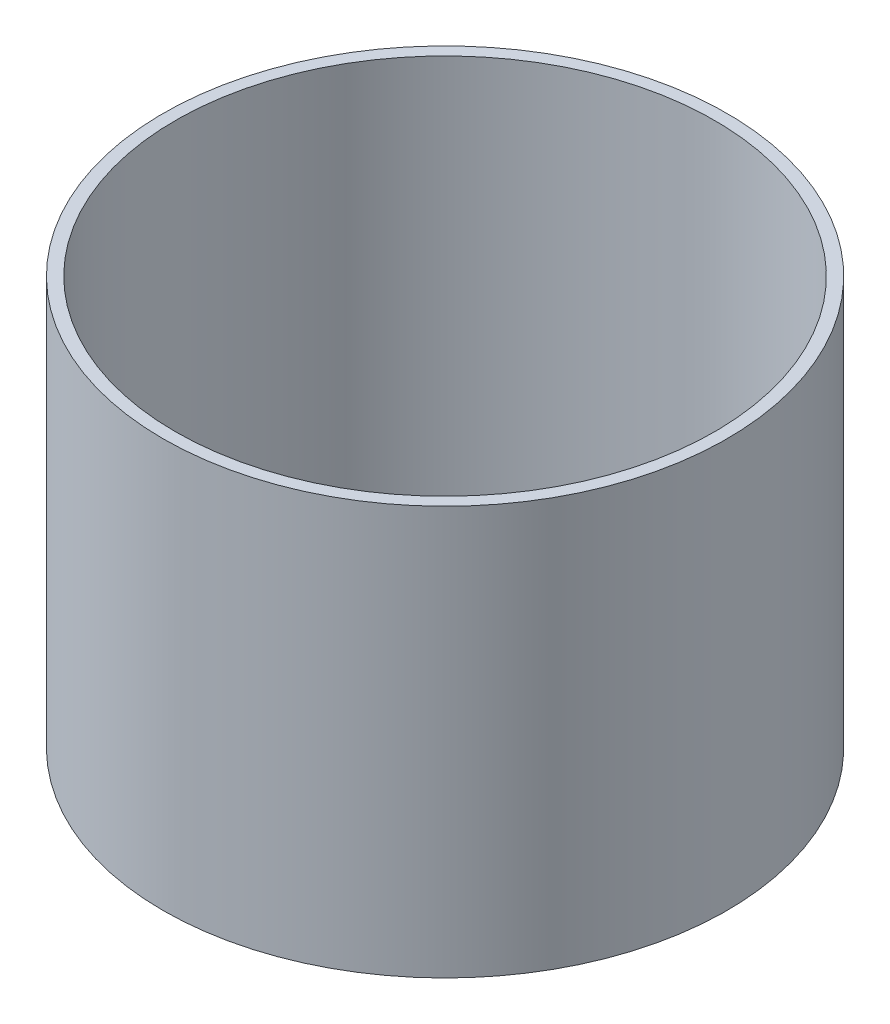
from build123d import *

# Parameters (mm, degrees)
SKETCH1_R           = 69
SKETCH1_R_2         = 66
BOSS_EXTRUDE1_DEPTH = 100
CUT_EXTRUDE1_REACH  = 200.784
SKETCH3_W           = 20
SKETCH3_H           = 28
FILLET1_R           = 3


with BuildPart() as part:
    # Sketch1 → Boss-Extrude1 (new body)
    with BuildSketch(Plane(origin=(0, 0, 0), x_dir=(1, 0, 0), z_dir=(0, 1, 0))):
        Circle(SKETCH1_R)
        Circle(SKETCH1_R_2, mode=Mode.SUBTRACT)
    extrude(amount=BOSS_EXTRUDE1_DEPTH)

    # Sketch3 → Cut-Extrude1 (cut, up to next)
    with BuildSketch(Plane(origin=(-62.177817942, 0, 41.93946776), x_dir=(-0.5591929034707485, 0, -0.8290375725550407), z_dir=(0.8290375725550406, 0, -0.5591929034707483)), mode=Mode.PRIVATE) as cut_extrude1_sk1:
        with Locations((0, 52.5)):
            Rectangle(SKETCH3_W, SKETCH3_H)
    cut_extrude1_tool1 = extrude(cut_extrude1_sk1.sketch, amount=CUT_EXTRUDE1_REACH, mode=Mode.PRIVATE) & part.part
    add(cut_extrude1_tool1.solids().sort_by_distance((-62.177818, 52.5, 41.939468))[0], mode=Mode.SUBTRACT)

    # Fillet1
    fillet1_edges = [part.edges().sort_by_distance(p)[0] for p in [
        (-49.750284469, 38.5, 45.619170075),
        (-60.934142538, 38.5, 29.038418624),
        (-49.750284469, 66.5, 45.619170075),
        (-60.934142538, 66.5, 29.038418624),
    ]]
    fillet(fillet1_edges, radius=FILLET1_R)


solid = part.part
